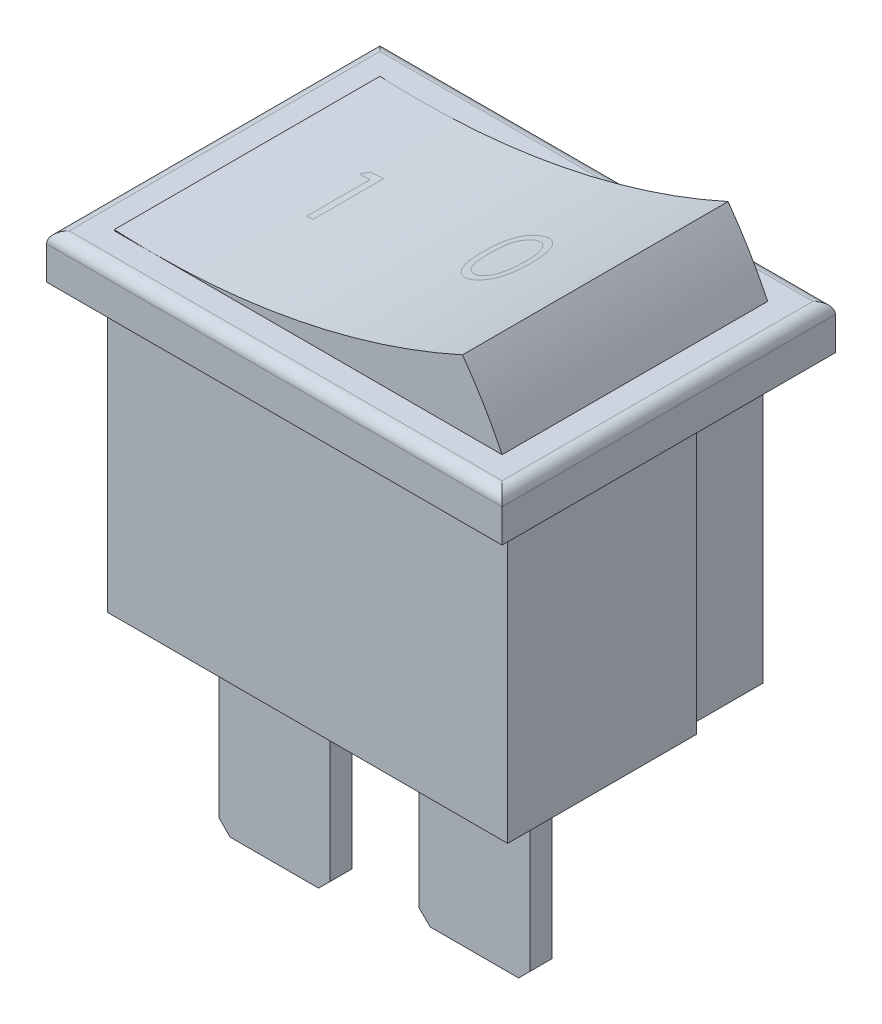
from build123d import *

# Parameters (mm, degrees)
BOSS_EXTRUDE1_DEPTH   = 13
SKETCH2_W             = 20.5
SKETCH2_H             = 15
BOSS_EXTRUDE2_DEPTH   = 2
FILLET1_R             = 0.508
SKETCH3_W             = 17.452
SKETCH3_H             = 11.952
BOSS_EXTRUDE3_DEPTH   = 3
CUT_EXTRUDE2_START    = -11.952
CUT_EXTRUDE2_DEPTH    = 11.952
SKETCH6_W             = 5
SKETCH6_H             = 1
BOSS_EXTRUDE4_DEPTH   = 8
BOSS_EXTRUDE4_2_DEPTH = 8
CHAMFER1_SIZE         = 0.508
CHAMFER2_SIZE         = 0.508


# Read off the part's stored shape, not the designer's step: Cut-Extrude2
with BuildPart() as part:
    # Sketch1 → Boss-Extrude1 (new body)
    with BuildSketch(Plane(origin=(0, 0, 0), x_dir=(1, 0, 0), z_dir=(0, 1, 0))):
        Polygon((-17.5, 12), (-17.5, 8.5), (-18, 8.5), (-18, 0), (0, 0), (0, 8.5), (-0.5, 8.5), (-0.5, 12), align=None)
    extrude(amount=BOSS_EXTRUDE1_DEPTH)

    # Sketch2 → Boss-Extrude2 (add)
    with BuildSketch(Plane(origin=(0, 13, 0), x_dir=(1, 0, 0), z_dir=(0, 1, 0))):
        with Locations((-9, 6)):
            Rectangle(SKETCH2_W, SKETCH2_H)
    extrude(amount=BOSS_EXTRUDE2_DEPTH)

    # Fillet1
    fillet1_edges = [part.edges().sort_by_distance(p)[0] for p in [
        (-19.25, 15, -6),
        (-9, 15, 1.5),
        (1.25, 15, -6),
        (-9, 15, -13.5),
    ]]
    fillet(fillet1_edges, radius=FILLET1_R)

    # Sketch3 → Boss-Extrude3 (add)
    with BuildSketch(Plane(origin=(0, 15, 0), x_dir=(1, 0, 0), z_dir=(0, 1, 0))):
        with Locations((-9, 6)):
            Rectangle(SKETCH3_W, SKETCH3_H)
    extrude(amount=BOSS_EXTRUDE3_DEPTH)

    # Cut-Extrude2 outline → Cut-Extrude2 (cut)
    with BuildSketch(Plane.XY.offset(-0.024).offset(CUT_EXTRUDE2_START)):
        with BuildLine():
            Line((-0.274, 18), (-2.056001882, 18))
            ThreePointArc((-2.056001882, 18), (-1.098307975, 16.539615664), (-0.274, 15))
            Line((-0.274, 15), (-0.274, 18))
        make_face()
        with BuildLine():
            ThreePointArc((-17.726, 15.047770582), (-9.713352624, 15.580954239), (-2.056001882, 18))
            Line((-2.056001882, 18), (-17.726, 18))
            Line((-17.726, 18), (-17.726, 15.047770582))
        make_face()
    extrude(amount=CUT_EXTRUDE2_DEPTH, mode=Mode.SUBTRACT)


with BuildPart() as body_2:
    # Sketch6 → Boss-Extrude4 (new body)
    with BuildSketch(Plane.XZ):
        with Locations((-4.5, -3.5)):
            Rectangle(SKETCH6_W, SKETCH6_H)
    extrude(amount=BOSS_EXTRUDE4_DEPTH)

    # Chamfer2
    chamfer2_edges = [body_2.edges().sort_by_distance(p)[0] for p in [
        (-2, -8, -3.5),
        (-7, -8, -3.5),
    ]]
    chamfer(chamfer2_edges, length=CHAMFER2_SIZE)


with BuildPart() as body_3:
    # Sketch6 → Boss-Extrude4 2 (new body)
    with BuildSketch(Plane.XZ):
        with Locations((-12.5, -2.5)):
            Rectangle(SKETCH6_W, SKETCH6_H)
    extrude(amount=BOSS_EXTRUDE4_2_DEPTH)

    # Chamfer1
    chamfer1_edges = [body_3.edges().sort_by_distance(p)[0] for p in [
        (-10, -8, -2.5),
        (-15, -8, -2.5),
    ]]
    chamfer(chamfer1_edges, length=CHAMFER1_SIZE)


solid = Compound([part.part, body_2.part, body_3.part])
